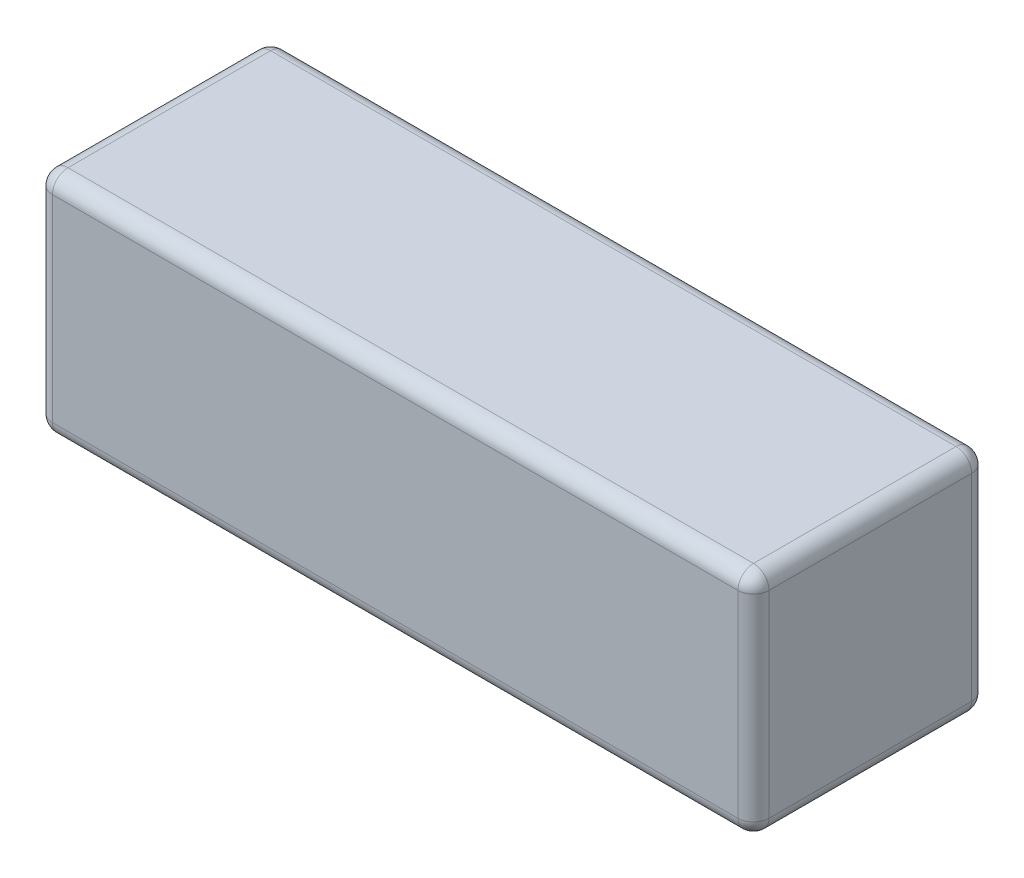
from build123d import *

# Parameters (mm, degrees)
SKETCH_1_W      = 138
SKETCH_1_H      = 44
EXTRUDE_1_DEPTH = 45
FILLET_1_R      = 3


with BuildPart() as part:
    # 草图1 → 凸台-拉伸1 (new body)
    with BuildSketch(Plane.XY):
        Rectangle(SKETCH_1_W, SKETCH_1_H)
    extrude(amount=EXTRUDE_1_DEPTH)

    # 圆角1
    fillet_1_edges = [part.edges().sort_by_distance(p)[0] for p in [
        (-69, 22, 22.5),
        (0, 22, 0),
        (-69, 0, 0),
        (-69, -22, 22.5),
        (0, -22, 0),
        (69, -22, 22.5),
        (69, 22, 22.5),
        (69, 0, 0),
        (0, 22, 45),
        (69, 0, 45),
        (0, -22, 45),
        (-69, 0, 45),
    ]]
    fillet(fillet_1_edges, radius=FILLET_1_R)


solid = part.part
